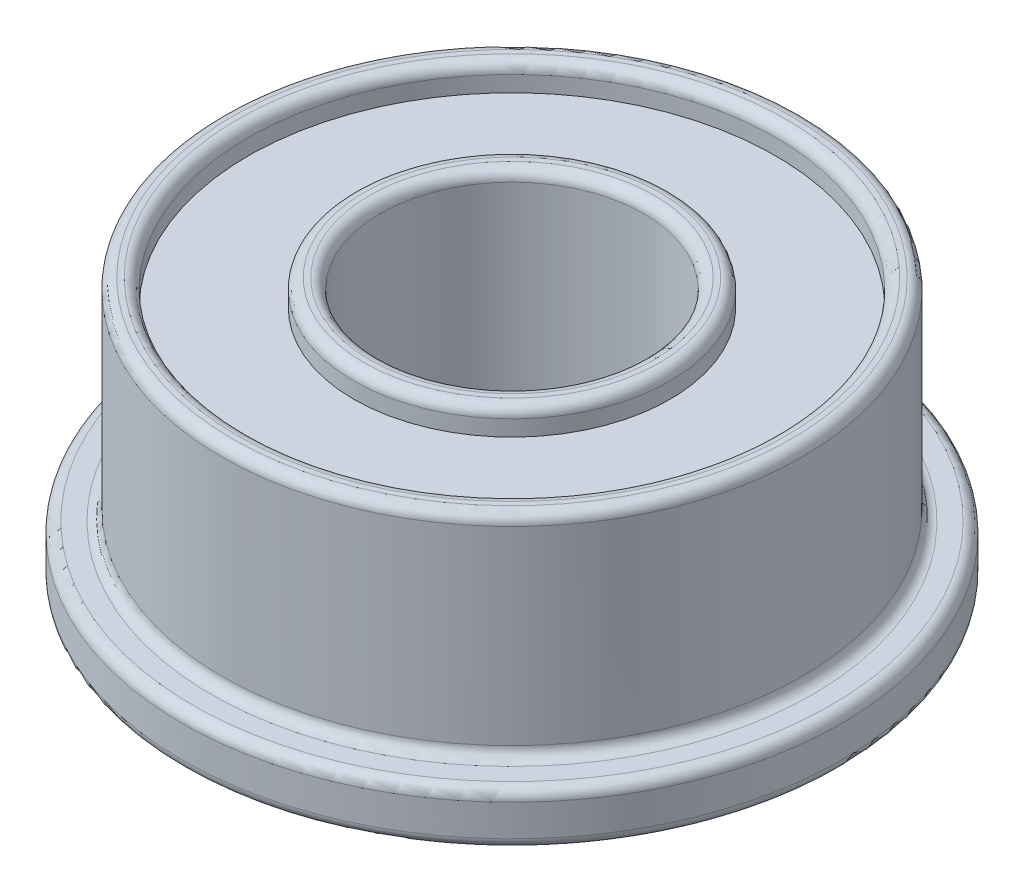
from build123d import *

# Parameters (mm, degrees)
SKETCH_1_R          = 5.5
SKETCH_1_R_2        = 2.5
EXTRUDE_1_DEPTH     = 2.5
EXTRUDE_START       = -1
SKETCH_2_R          = 6.25
SKETCH_2_R_2        = 5.5
EXTRUDE_1_2_DEPTH   = 1
SKETCH_3_R          = 5
SKETCH_3_R_2        = 3
CUT_EXTRUDE_1_DEPTH = 0.5
FILLET_1_R          = 0.2
FILLET_2_R          = 0.2


with BuildPart() as part:
    # ｽｹｯﾁ1 → Extrude 1 (new, symmetric)
    with BuildSketch(Plane(origin=(0, 0, 0), x_dir=(1, 0, 0), z_dir=(0, 1, 0))):
        Circle(SKETCH_1_R)
        Circle(SKETCH_1_R_2, mode=Mode.SUBTRACT)
    extrude(amount=EXTRUDE_1_DEPTH, both=True)

    # ｽｹｯﾁ2 → Extrude 1 2 (add)
    with BuildSketch(Plane.XZ.offset(2.5).offset(EXTRUDE_START)):
        Circle(SKETCH_2_R)
        Circle(SKETCH_2_R_2, mode=Mode.SUBTRACT)
    extrude(amount=EXTRUDE_1_2_DEPTH)

    # ｽｹｯﾁ3 → ｶｯﾄ - 押し出し1 (cut, symmetric)
    with BuildSketch(Plane(origin=(0, 2.5, 0), x_dir=(1, 0, 0), z_dir=(0, 1, 0))):
        Circle(SKETCH_3_R)
        Circle(SKETCH_3_R_2, mode=Mode.SUBTRACT)
    cut_extrude_1 = extrude(amount=CUT_EXTRUDE_1_DEPTH, both=True, mode=Mode.SUBTRACT)

    # ﾐﾗｰ1: ｶｯﾄ - 押し出し1 across plane
    add(cut_extrude_1.mirror(Plane.ZX), mode=Mode.SUBTRACT)

    # ﾌｨﾚｯﾄ1
    fillet_1_edges = [part.edges().sort_by_distance(p)[0] for p in [
        (-5, -2.5, 0),
        (-3, -2.5, 0),
        (-5, 2.5, 0),
        (-3, 2.5, 0),
        (-6.25, -2.5, 0),
        (-2.5, -2.5, 0),
        (-2.5, 2.5, 0),
        (-5.5, -1.5, 0),
        (-5.5, 2.5, 0),
    ]]
    fillet(fillet_1_edges, radius=FILLET_1_R)

    # ﾌｨﾚｯﾄ2
    fillet_2_edges = [part.edges().sort_by_distance(p)[0] for p in [
        (-6.25, -1.5, 0),
    ]]
    fillet(fillet_2_edges, radius=FILLET_2_R)


solid = part.part
